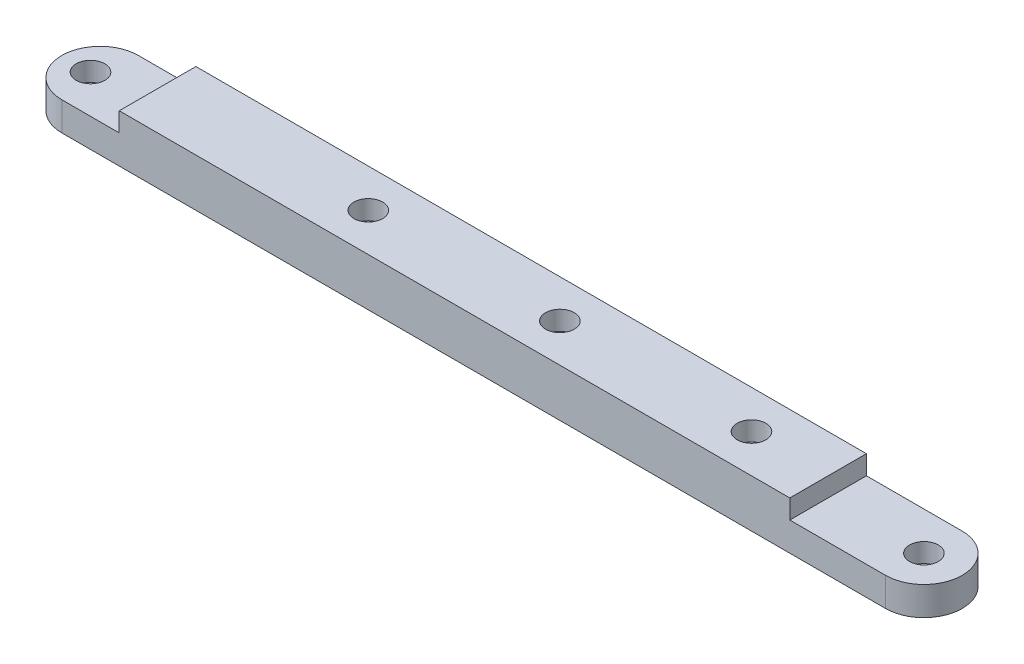
from build123d import *

# Parameters (mm, degrees)
BOSS_EXTRUDE2_DEPTH = 3
SKETCH3_W           = 80
SKETCH3_H           = 8
BOSS_EXTRUDE3_DEPTH = 2
SKETCH4_R           = 1.5
CUT_EXTRUDE5_DEPTH  = 2
SKETCH12_R          = 1.5
CUT_EXTRUDE6_DEPTH  = 2
SKETCH16_W          = 10
SKETCH16_H          = 8
CUT_EXTRUDE7_DEPTH  = 2
SKETCH17_R          = 1.5
CUT_EXTRUDE8_DEPTH  = 2
FILLET1_R           = 4


with BuildPart() as part:
    # Sketch1 → Boss-Extrude2 (new body)
    with BuildSketch(Plane(origin=(0, 0, 0), x_dir=(1, 0, 0), z_dir=(0, 1, 0))):
        with BuildLine():
            Line((-25, -4), (65, -4))
            ThreePointArc((65, -4), (69, 0), (65, 4))
            Line((65, 4), (-25, 4))
            Line((-25, 4), (-25, -4))
        make_face()
    extrude(amount=BOSS_EXTRUDE2_DEPTH)

    # Sketch3 → Boss-Extrude3 (add)
    with BuildSketch(Plane(origin=(0, 3, 0), x_dir=(1, 0, 0), z_dir=(0, 1, 0))):
        with Locations((15, 0)):
            Rectangle(SKETCH3_W, SKETCH3_H)
    extrude(amount=BOSS_EXTRUDE3_DEPTH)

    # Sketch4 → Cut-Extrude5 (cut)
    with BuildSketch(Plane(origin=(0, 3, 0), x_dir=(1, 0, 0), z_dir=(0, 1, 0))):
        with Locations(Location((65, 0, 0), (0, 0, 270))):
            Circle(SKETCH4_R)
    extrude(amount=-CUT_EXTRUDE5_DEPTH, mode=Mode.SUBTRACT)

    # Sketch12 → Cut-Extrude6 (cut)
    with BuildSketch(Plane(origin=(0, 5, 0), x_dir=(1, 0, 0), z_dir=(0, 1, 0))):
        with Locations(Location((47, 0, 0), (0, 0, 270))):
            Circle(SKETCH12_R)
        with Locations(Location((27, 0, 0), (0, 0, 270))):
            Circle(SKETCH12_R)
        with Locations(Location((7, 0, 0), (0, 0, 270))):
            Circle(SKETCH12_R)
    extrude(amount=-CUT_EXTRUDE6_DEPTH, mode=Mode.SUBTRACT)

    # Sketch16 → Cut-Extrude7 (cut)
    with BuildSketch(Plane(origin=(0, 5, 0), x_dir=(1, 0, 0), z_dir=(0, 1, 0))):
        with Locations((-20, 0)):
            Rectangle(SKETCH16_W, SKETCH16_H)
    extrude(amount=-CUT_EXTRUDE7_DEPTH, mode=Mode.SUBTRACT)

    # Sketch17 → Cut-Extrude8 (cut)
    with BuildSketch(Plane(origin=(0, 3, 0), x_dir=(1, 0, 0), z_dir=(0, 1, 0))):
        with Locations(Location((-22, 0, 0), (0, 0, 270))):
            Circle(SKETCH17_R)
    extrude(amount=-CUT_EXTRUDE8_DEPTH, mode=Mode.SUBTRACT)

    # Fillet1
    fillet1_edges = [part.edges().sort_by_distance(p)[0] for p in [
        (-25, 1.5, -4),
        (-25, 1.5, 4),
    ]]
    fillet(fillet1_edges, radius=FILLET1_R - 0.0001)  # a hair under: the kernel refuses the full size


solid = part.part
